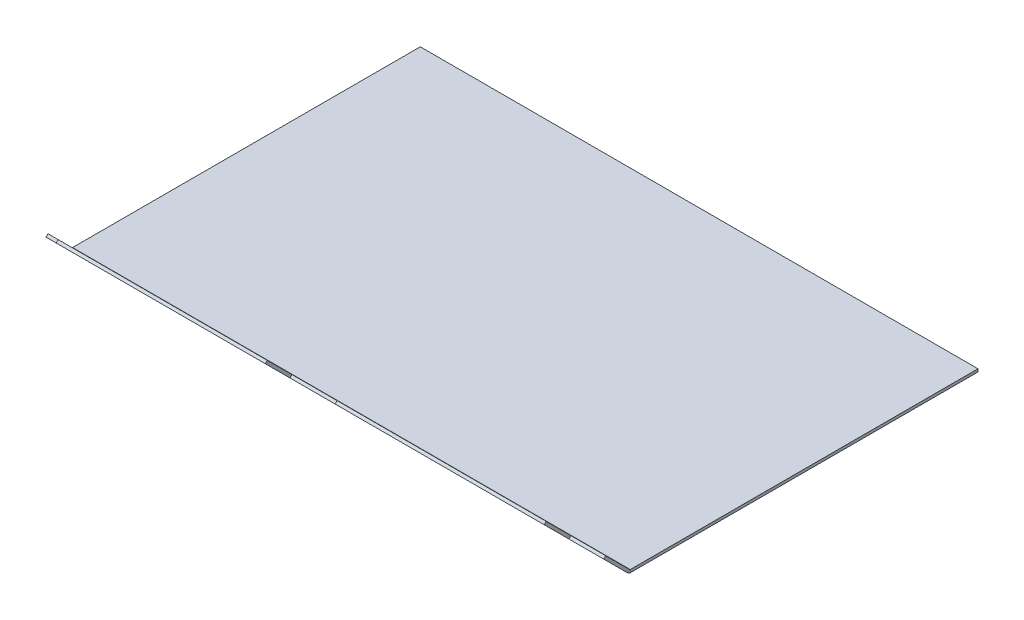
from build123d import *

# Parameters (mm, degrees)
ESBO_O1_W               = 400
ESBO_O1_H               = 300
FLANGE_BASE1_DEPTH      = 2
DOBRA_START             = -200
DOBRA_ESBO_ADA1_DEPTH   = 400
DOBRA_ESBO_ADA1_2_DEPTH = 400
ESBO_O9_W               = 25
ESBO_O9_H               = 25
ESBO_O9_W_2             = 50
CORTE_EXTRUS_O1_DEPTH   = 2


# Read off the part's stored shape, not the designer's step: Dobra esboçada1
# Sheet-metal steps are written as plain solids
with BuildPart() as part:
    # Esboço1 → Flange-base1 (new body)
    with BuildSketch(Plane(origin=(0, 0, 0), x_dir=(1, 0, 0), z_dir=(0, 1, 0))):
        with Locations((0, 150)):
            Rectangle(ESBO_O1_W, ESBO_O1_H)
    extrude(amount=-FLANGE_BASE1_DEPTH)

    # Dobra esboçada1 outline → Dobra esboçada1 (cut)
    with BuildSketch(Plane.YZ.offset(DOBRA_START)):
        with BuildLine():
            Line((-1.198468417, -48.746892808), (0, -47.548424391))
            Line((0, -47.548424391), (0, 0))
            Line((0, 0), (-2, 0))
            Line((-2, 0), (-2, -50.681961225))
            ThreePointArc((-2, -50.681961225), (-1.791688729, -49.634709744), (-1.198468417, -48.746892808))
        make_face()
    extrude(amount=DOBRA_ESBO_ADA1_DEPTH, mode=Mode.SUBTRACT)

    # Dobra esbo_ada1 2 outline → Dobra esbo_ada1 2 (add)
    with BuildSketch(Plane.YZ.offset(DOBRA_START)):
        with BuildLine():
            Line((35.088864797, -15.287986718), (33.674651235, -13.873773155))
            Line((33.674651235, -13.873773155), (0, -47.548424391))
            Line((0, -47.548424391), (0, -50.681961225))
            ThreePointArc((0, -50.681961225), (0.056070336, -50.400076609), (0.215745145, -50.16110637))
            Line((0.215745145, -50.16110637), (35.088864797, -15.287986718))
        make_face()
    extrude(amount=DOBRA_ESBO_ADA1_2_DEPTH)

    # Esboço9 → Corte-extrusão1 (cut)
    with BuildSketch(Plane(origin=(0, 25.188425758, -25.188425758), x_dir=(1, 0, 0), z_dir=(0, 0.7071067811865464, -0.7071067811865488))):
        with Locations((-187.5, -1.501335164)):
            Rectangle(ESBO_O9_W, ESBO_O9_H)
        with Locations((0, -1.501335164)):
            Rectangle(ESBO_O9_W_2, ESBO_O9_H)
        with Locations((187.5, -1.501335164)):
            Rectangle(ESBO_O9_W, ESBO_O9_H)
    extrude(amount=-CORTE_EXTRUS_O1_DEPTH, mode=Mode.SUBTRACT)


solid = part.part
